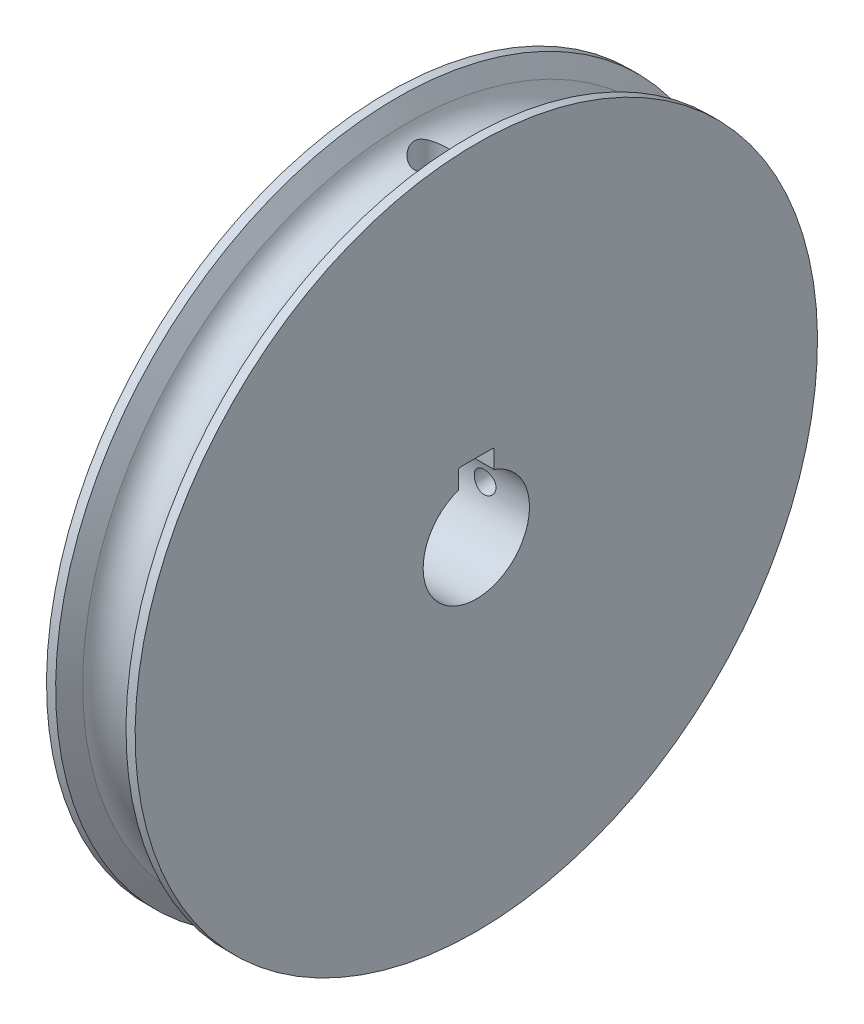
from build123d import *

# Parameters (mm, degrees)
CUT_EXTRUDE1_DEPTH                               = 56.357926262
SKETCH3_W                                        = 10
SKETCH3_H                                        = 6
CBORE_START                                      = -35.263917504
CBORE_FOR_M2_HEX_HEAD_MACHINE_SCREW1_OUT_R       = 2
CBORE_FOR_M2_HEX_HEAD_MACHINE_SCREW1_DEPTH       = 23.263917504
CBORE_START_2                                    = -12
CBORE_FOR_M2_HEX_HEAD_MACHINE_SCREW1_2_O_R       = 1.2295
CBORE_FOR_M2_HEX_HEAD_MACHINE_SCREW1_2_DEPTH     = 6.12732314
CBORE_FOR_M2_HEX_HEAD_MACHINE_SCREW2_D           = 2.459
CBORE_FOR_M2_HEX_HEAD_MACHINE_SCREW2_DEPTH       = 27.463932023
CBORE_FOR_M2_HEX_HEAD_MACHINE_SCREW2_CBORE_D     = 4
CBORE_FOR_M2_HEX_HEAD_MACHINE_SCREW2_CBORE_DEPTH = 23.263932023
CHAMFER1_SIZE                                    = 0.2705
FILLET1_R                                        = 0.2


# Read off the part's stored shape, not the designer's step: CBORE for M2 Hex Head Machine Screw1
with BuildPart() as part:
    # Sketch1 → Revolve1 (revolve)
    with BuildSketch(Plane(origin=(0, 0, 0), x_dir=(-1, 0, 0), z_dir=(0, 0, -1)), mode=Mode.PRIVATE) as revolve1_sk:
        with BuildLine():
            Line((-5, 38.5), (-5, 0))
            Line((-5, 0), (5, 0))
            Line((5, 0), (5, 38.5))
            Line((5, 38.5), (3.968118785, 38.5))
            Line((3.968118785, 38.5), (2.850084796, 36.563508327))
            ThreePointArc((2.850084796, 36.563508327), (0, 34.5), (-2.850084796, 36.563508327))
            Line((-2.850084796, 36.563508327), (-3.968118785, 38.5))
            Line((-3.968118785, 38.5), (-5, 38.5))
        make_face()
    revolve(revolve1_sk.sketch.rotate(Axis((5, 0, 0), (-1, 0, 0)), 180), axis=Axis((5, 0, 0), (-1, 0, 0)))

    # Sketch2 → Cut-Extrude1 (cut, through all)
    with BuildSketch(Plane.ZY.offset(5)):
        with BuildLine():
            Line((2, 5.656854249), (2, 7.8))
            Line((2, 7.8), (-2, 7.8))
            Line((-2, 7.8), (-2, 5.656854249))
            ThreePointArc((-2, 5.656854249), (0, 6), (2, 5.656854249))
        make_face()
    extrude(amount=-CUT_EXTRUDE1_DEPTH, mode=Mode.SUBTRACT)

    # Sketch3 → Cut-Revolve1 (revolve, cut)
    with BuildSketch(Plane(origin=(0, 0, 0), x_dir=(-1, 0, 0), z_dir=(0, 0, -1)), mode=Mode.PRIVATE) as cut_revolve1_sk:
        with Locations((0, 3)):
            Rectangle(SKETCH3_W, SKETCH3_H)
    revolve(cut_revolve1_sk.sketch.rotate(Axis((5, 0, 0), (-1, 0, 0)), 180), axis=Axis((5, 0, 0), (-1, 0, 0)), mode=Mode.SUBTRACT)

    # CBORE for M2 Hex Head Machine Screw1 out → CBORE for M2 Hex Head Machine Screw1 (cut)
    with BuildSketch(Plane.XY.offset(CBORE_START)):
        Circle(CBORE_FOR_M2_HEX_HEAD_MACHINE_SCREW1_OUT_R)
    extrude(amount=CBORE_FOR_M2_HEX_HEAD_MACHINE_SCREW1_DEPTH, mode=Mode.SUBTRACT)

    # CBORE for M2 Hex Head Machine Screw1 2 o → CBORE for M2 Hex Head Machine Screw1 2 (cut)
    with BuildSketch(Plane.XY.offset(CBORE_START_2)):
        Circle(CBORE_FOR_M2_HEX_HEAD_MACHINE_SCREW1_2_O_R)
    extrude(amount=CBORE_FOR_M2_HEX_HEAD_MACHINE_SCREW1_2_DEPTH, mode=Mode.SUBTRACT)

    # CBORE for M2 Hex Head Machine Screw2
    with Locations(Plane(origin=(0, 35.263932023, 0), x_dir=(1, 0, 0), z_dir=(0, 1, 0))):
        with Locations((0, 0)):
            CounterBoreHole(CBORE_FOR_M2_HEX_HEAD_MACHINE_SCREW2_D / 2, CBORE_FOR_M2_HEX_HEAD_MACHINE_SCREW2_CBORE_D / 2, CBORE_FOR_M2_HEX_HEAD_MACHINE_SCREW2_CBORE_DEPTH, depth=CBORE_FOR_M2_HEX_HEAD_MACHINE_SCREW2_DEPTH)

    # Chamfer1
    chamfer1_edges = [part.edges().sort_by_distance(p)[0] for p in [
        (-1.2295, 0, -12),
        (1.2295, 12, 0),
    ]]
    chamfer(chamfer1_edges, length=CHAMFER1_SIZE)

    # Fillet1
    fillet1_edges = [part.edges().sort_by_distance(p)[0] for p in [
        (0, 7.8, -2),
        (0, 7.8, 2),
    ]]
    fillet(fillet1_edges, radius=FILLET1_R)


solid = part.part
